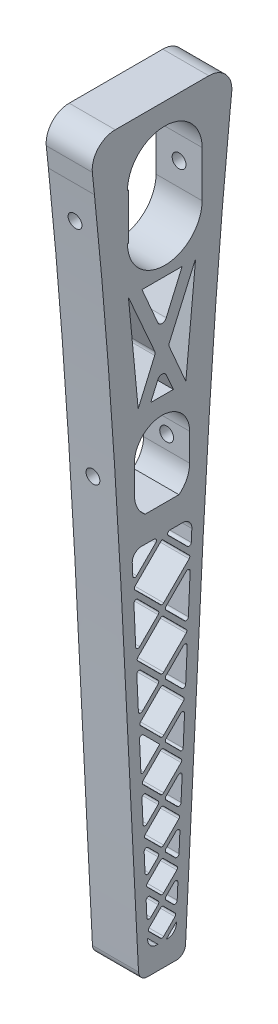
from build123d import *

# Parameters (mm, degrees)
BOSS_EXTRUDE1_DEPTH      = 5
BOSS_EXTRUDE1_DEPTH_BACK = 5
CUT_EXTRUDE1_DEPTH       = 28
CUT_EXTRUDE1_DEPTH_BACK  = 20
SKETCH4_R                = 1.5
CUT_EXTRUDE2_DEPTH       = 20
CUT_EXTRUDE2_DEPTH_BACK  = 20
SKETCH5_R                = 1.5
SKETCH6_W                = 10
SKETCH6_H                = 10
SKETCH6_R                = 1.5
BOSS_EXTRUDE2_DEPTH      = 0.2
SKETCH7_W                = 10
SKETCH7_H                = 10
SKETCH7_R                = 1.5
CUT_EXTRUDE3_DEPTH       = 1.2
SKETCH8_W                = 10
SKETCH8_H                = 6
SKETCH8_R                = 1.5
CUT_EXTRUDE4_DEPTH       = 1
SKETCH9_W                = 10
SKETCH9_H                = 6
SKETCH9_R                = 1.5
CUT_EXTRUDE5_DEPTH       = 1
FILLET6_R                = 1
CUT_EXTRUDE10_DEPTH      = 10
CUT_EXTRUDE11_DEPTH      = 10
CUT_EXTRUDE12_DEPTH      = 10
BOSS_EXTRUDE3_DEPTH      = 10
FILLET7_R                = 5
CUT_EXTRUDE13_DEPTH      = 10
FILLET8_R                = 2


with BuildPart() as part:
    # Sketch3 → Boss-Extrude1 (new, two sides: drawn at the far end of the back side and taken through both)
    with BuildSketch(Plane(origin=(0, 0, 0), x_dir=(0, 0, -1), z_dir=(1, 0, 0)).offset(-BOSS_EXTRUDE1_DEPTH_BACK)):
        with BuildLine():
            ThreePointArc((14.673342054, 7.823553619), (13.413781291, 11.688048034), (9.700098666, 13.340129074))
            Line((9.700098666, 13.340129074), (-9.700098666, 13.340129074))
            ThreePointArc((-9.700098666, 13.340129074), (-13.413781291, 11.688048034), (-14.673342054, 7.823553619))
            add(Edge.make_bspline(
                [(-14.673342054, 7.823553619), (-9.398583111, -42.958301773), (-7.813515176, -94.068374443), (-5, -145)],
                knots=[0.014278199, 0.014278199, 0.014278199, 0.014278199, 1, 1, 1, 1], degree=3))
            Line((-5, -145), (5, -145))
            add(Edge.make_bspline(
                [(14.673342054, 7.823553619), (9.398583111, -42.958301773), (7.813515176, -94.068374443), (5, -145)],
                knots=[0.014278199, 0.014278199, 0.014278199, 0.014278199, 1, 1, 1, 1], degree=3))
        make_face()
        with BuildLine():
            Line((-3.129448831, -138), (-3.129448831, -137.773163477))
            Line((-3.129448831, -137.773163477), (-0.902612308, -140))
            Line((-0.902612308, -140), (-1.129448831, -140))
            ThreePointArc((-1.129448831, -140), (-2.543662393, -139.414213562), (-3.129448831, -138))
        make_face(mode=Mode.SUBTRACT)
        with BuildLine():
            Line((-3.28908311, -133.832708929), (-3.443508103, -130.513250922))
            ThreePointArc((-3.443508103, -130.513250922), (-3.146074586, -130.032647605), (-2.59049489, -130.136462088))
            Line((-2.59049489, -130.136462088), (-0.853553391, -131.873403588))
            ThreePointArc((-0.853553391, -131.873403588), (-0.707106781, -132.226956978), (-0.853553391, -132.580510369))
            Line((-0.853553391, -132.580510369), (-2.436069897, -134.163026876))
            ThreePointArc((-2.436069897, -134.163026876), (-2.970177042, -134.275735581), (-3.28908311, -133.832708929))
        make_face(mode=Mode.SUBTRACT)
        with BuildLine():
            Line((-3.687981166, -125.258155544), (-3.881331395, -121.101976191))
            ThreePointArc((-3.881331395, -121.101976191), (-3.583897878, -120.621372874), (-3.028318182, -120.725187357))
            Line((-3.028318182, -120.725187357), (-0.853553391, -122.899952148))
            ThreePointArc((-0.853553391, -122.899952148), (-0.707106781, -123.253505539), (-0.853553391, -123.607058929))
            Line((-0.853553391, -123.607058929), (-2.834967953, -125.588473491))
            ThreePointArc((-2.834967953, -125.588473491), (-3.369075098, -125.701182196), (-3.687981166, -125.258155544))
        make_face(mode=Mode.SUBTRACT)
        with BuildLine():
            Line((-4.125804458, -115.846880813), (-4.166694273, -114.967929655))
            Line((-4.166694273, -114.967929655), (-4.361878322, -110.77233124))
            ThreePointArc((-4.361878322, -110.77233124), (-4.064444805, -110.291727923), (-3.508865109, -110.395542406))
            Line((-3.508865109, -110.395542406), (-0.853553391, -113.050854125))
            ThreePointArc((-0.853553391, -113.050854125), (-0.707106781, -113.404407515), (-0.853553391, -113.757960906))
            Line((-0.853553391, -113.757960906), (-3.272791245, -116.17719876))
            ThreePointArc((-3.272791245, -116.17719876), (-3.80689839, -116.289907465), (-4.125804458, -115.846880813))
        make_face(mode=Mode.SUBTRACT)
        with BuildLine():
            ThreePointArc((-4.88931794, -99.434699745), (-4.591884423, -98.954096428), (-4.036304727, -99.057910911))
            Line((-4.036304727, -99.057910911), (-0.5, -102.594215637))
            Line((-0.5, -102.594215637), (-3.993461302, -106.087676939))
            ThreePointArc((-3.993461302, -106.087676939), (-4.367336303, -106.166573032), (-4.590570551, -105.856454376))
            Line((-4.590570551, -105.856454376), (-4.88931794, -99.434699745))
        make_face(mode=Mode.SUBTRACT)
        with BuildLine():
            Line((-5.133791002, -94.179604367), (-5.468226125, -86.990720447))
            ThreePointArc((-5.468226125, -86.990720447), (-5.170792608, -86.510117129), (-4.615212912, -86.613931613))
            Line((-4.615212912, -86.613931613), (-0.853553391, -90.375591134))
            ThreePointArc((-0.853553391, -90.375591134), (-0.707106781, -90.729144525), (-0.853553391, -91.082697915))
            Line((-0.853553391, -91.082697915), (-4.280777789, -94.509922314))
            ThreePointArc((-4.280777789, -94.509922314), (-4.814884934, -94.622631019), (-5.133791002, -94.179604367))
        make_face(mode=Mode.SUBTRACT)
        with BuildLine():
            Line((-6.348098343, -68.07733843), (-6.46774261, -65.505513021))
            ThreePointArc((-6.46774261, -65.505513021), (-5.916603626, -64.031608457), (-4.469903321, -63.412571246))
            Line((-4.469903321, -63.412571246), (-1.707106781, -63.412571246))
            ThreePointArc((-1.707106781, -63.412571246), (-1.245167015, -63.72122953), (-1.353553391, -64.266124637))
            Line((-1.353553391, -64.266124637), (-5.49508513, -68.407656377))
            ThreePointArc((-5.49508513, -68.407656377), (-6.029192275, -68.520365082), (-6.348098343, -68.07733843))
        make_face(mode=Mode.SUBTRACT)
        with BuildLine():
            Line((-5.712699188, -81.735625069), (-6.103625281, -73.332433808))
            ThreePointArc((-6.103625281, -73.332433808), (-5.806191764, -72.85183049), (-5.250612068, -72.955644973))
            Line((-5.250612068, -72.955644973), (-0.853553391, -77.35270365))
            ThreePointArc((-0.853553391, -77.35270365), (-0.707106781, -77.706257041), (-0.853553391, -78.059810432))
            Line((-0.853553391, -78.059810432), (-4.859685975, -82.065943016))
            ThreePointArc((-4.859685975, -82.065943016), (-5.39379312, -82.178651721), (-5.712699188, -81.735625069))
        make_face(mode=Mode.SUBTRACT)
        with BuildLine():
            Line((-2.820060712, -135.961231252), (-0.353553391, -133.494723931))
            ThreePointArc((-0.353553391, -133.494723931), (0, -133.348277322), (0.353553391, -133.494723931))
            Line((0.353553391, -133.494723931), (2.820060712, -135.961231252))
            ThreePointArc((2.820060712, -135.961231252), (2.966507321, -136.314784643), (2.820060712, -136.668338034))
            Line((2.820060712, -136.668338034), (0.353553391, -139.134845355))
            ThreePointArc((0.353553391, -139.134845355), (0, -139.281291964), (-0.353553391, -139.134845355))
            Line((-0.353553391, -139.134845355), (-2.820060712, -136.668338034))
            ThreePointArc((-2.820060712, -136.668338034), (-2.966507321, -136.314784643), (-2.820060712, -135.961231252))
        make_face(mode=Mode.SUBTRACT)
        with BuildLine():
            Line((3.129494185, -137.773118123), (3.129494185, -138))
            ThreePointArc((3.129494185, -138), (2.543707747, -139.414213562), (1.129494185, -140))
            Line((1.129494185, -140), (0.902612308, -140))
            Line((0.902612308, -140), (3.129494185, -137.773118123))
        make_face(mode=Mode.SUBTRACT)
        with BuildLine():
            Line((-3.218958767, -127.386677868), (-0.353553391, -124.521272492))
            ThreePointArc((-0.353553391, -124.521272492), (0, -124.374825882), (0.353553391, -124.521272492))
            Line((0.353553391, -124.521272492), (3.218958767, -127.386677868))
            ThreePointArc((3.218958767, -127.386677868), (3.365405376, -127.740231259), (3.218958767, -128.093784649))
            Line((3.218958767, -128.093784649), (0.353553391, -130.959190025))
            ThreePointArc((0.353553391, -130.959190025), (0, -131.105636635), (-0.353553391, -130.959190025))
            Line((-0.353553391, -130.959190025), (-3.218958767, -128.093784649))
            ThreePointArc((-3.218958767, -128.093784649), (-3.365405376, -127.740231259), (-3.218958767, -127.386677868))
        make_face(mode=Mode.SUBTRACT)
        with BuildLine():
            ThreePointArc((3.28908311, -133.832708929), (2.970177042, -134.275735581), (2.436069897, -134.163026876))
            Line((2.436069897, -134.163026876), (0.853553391, -132.580510369))
            ThreePointArc((0.853553391, -132.580510369), (0.707106781, -132.226956978), (0.853553391, -131.873403588))
            Line((0.853553391, -131.873403588), (2.59049489, -130.136462088))
            ThreePointArc((2.59049489, -130.136462088), (3.146074586, -130.032647605), (3.443508103, -130.513250922))
            Line((3.443508103, -130.513250922), (3.28908311, -133.832708929))
        make_face(mode=Mode.SUBTRACT)
        with BuildLine():
            ThreePointArc((-0.353553391, -114.672174468), (0, -114.525727859), (0.353553391, -114.672174468))
            Line((0.353553391, -114.672174468), (3.656782059, -117.975403136))
            ThreePointArc((3.656782059, -117.975403136), (3.803228668, -118.328956527), (3.656782059, -118.682509918))
            Line((3.656782059, -118.682509918), (0.353553391, -121.985738586))
            ThreePointArc((0.353553391, -121.985738586), (0, -122.132185195), (-0.353553391, -121.985738586))
            Line((-0.353553391, -121.985738586), (-3.656782059, -118.682509918))
            ThreePointArc((-3.656782059, -118.682509918), (-3.803228668, -118.328956527), (-3.656782059, -117.975403136))
            Line((-3.656782059, -117.975403136), (-0.353553391, -114.672174468))
        make_face(mode=Mode.SUBTRACT)
        with BuildLine():
            ThreePointArc((3.687981166, -125.258155544), (3.369075098, -125.701182196), (2.834967953, -125.588473491))
            Line((2.834967953, -125.588473491), (0.853553391, -123.607058929))
            ThreePointArc((0.853553391, -123.607058929), (0.707106781, -123.253505539), (0.853553391, -122.899952148))
            Line((0.853553391, -122.899952148), (3.028318182, -120.725187357))
            ThreePointArc((3.028318182, -120.725187357), (3.583897878, -120.621372874), (3.881331395, -121.101976191))
            Line((3.881331395, -121.101976191), (3.687981166, -125.258155544))
        make_face(mode=Mode.SUBTRACT)
        with BuildLine():
            Line((-4.137328986, -107.645758186), (-0.353553391, -103.86198259))
            ThreePointArc((-0.353553391, -103.86198259), (0, -103.715535981), (0.353553391, -103.86198259))
            Line((0.353553391, -103.86198259), (4.137328986, -107.645758186))
            ThreePointArc((4.137328986, -107.645758186), (4.283775595, -107.999311576), (4.137328986, -108.352864967))
            Line((4.137328986, -108.352864967), (0.353553391, -112.136640562))
            ThreePointArc((0.353553391, -112.136640562), (0, -112.283087172), (-0.353553391, -112.136640562))
            Line((-0.353553391, -112.136640562), (-4.137328986, -108.352864967))
            ThreePointArc((-4.137328986, -108.352864967), (-4.283775595, -107.999311576), (-4.137328986, -107.645758186))
        make_face(mode=Mode.SUBTRACT)
        with BuildLine():
            ThreePointArc((4.125804458, -115.846880813), (3.80689839, -116.289907465), (3.272791245, -116.17719876))
            Line((3.272791245, -116.17719876), (0.853553391, -113.757960906))
            ThreePointArc((0.853553391, -113.757960906), (0.707106781, -113.404407515), (0.853553391, -113.050854125))
            Line((0.853553391, -113.050854125), (3.508865109, -110.395542406))
            ThreePointArc((3.508865109, -110.395542406), (4.064444805, -110.291727923), (4.361878322, -110.77233124))
            Line((4.361878322, -110.77233124), (4.125804458, -115.846880813))
        make_face(mode=Mode.SUBTRACT)
        with BuildLine():
            Line((-4.664768603, -96.30812669), (-0.353553391, -91.996911478))
            ThreePointArc((-0.353553391, -91.996911478), (0, -91.850464868), (0.353553391, -91.996911478))
            Line((0.353553391, -91.996911478), (4.664768603, -96.30812669))
            ThreePointArc((4.664768603, -96.30812669), (4.811215213, -96.661680081), (4.664768603, -97.015233472))
            Line((4.664768603, -97.015233472), (0.353553391, -101.326448684))
            ThreePointArc((0.353553391, -101.326448684), (0, -101.472895294), (-0.353553391, -101.326448684))
            Line((-0.353553391, -101.326448684), (-4.664768603, -97.015233472))
            ThreePointArc((-4.664768603, -97.015233472), (-4.811215213, -96.661680081), (-4.664768603, -96.30812669))
        make_face(mode=Mode.SUBTRACT)
        with BuildLine():
            ThreePointArc((4.036304727, -99.057910911), (4.591884423, -98.954096428), (4.88931794, -99.434699745))
            Line((4.88931794, -99.434699745), (4.590570551, -105.856454376))
            ThreePointArc((4.590570551, -105.856454376), (4.367336303, -106.166573032), (3.993461302, -106.087676939))
            Line((3.993461302, -106.087676939), (0.853553391, -102.947769028))
            ThreePointArc((0.853553391, -102.947769028), (0.707106781, -102.594215637), (0.853553391, -102.240662247))
            Line((0.853553391, -102.240662247), (4.036304727, -99.057910911))
        make_face(mode=Mode.SUBTRACT)
        with BuildLine():
            ThreePointArc((4.615212912, -86.613931613), (5.170792608, -86.510117129), (5.468226125, -86.990720447))
            Line((5.468226125, -86.990720447), (5.133791002, -94.179604367))
            ThreePointArc((5.133791002, -94.179604367), (4.814884934, -94.622631019), (4.280777789, -94.509922314))
            Line((4.280777789, -94.509922314), (0.853553391, -91.082697915))
            ThreePointArc((0.853553391, -91.082697915), (0.707106781, -90.729144525), (0.853553391, -90.375591134))
            Line((0.853553391, -90.375591134), (4.615212912, -86.613931613))
        make_face(mode=Mode.SUBTRACT)
        with BuildLine():
            ThreePointArc((-5.243676789, -84.571254173), (-5.390123398, -84.217700783), (-5.243676789, -83.864147392))
            Line((-5.243676789, -83.864147392), (-0.353553391, -78.974023994))
            ThreePointArc((-0.353553391, -78.974023994), (0, -78.827577385), (0.353553391, -78.974023994))
            Line((0.353553391, -78.974023994), (5.243676789, -83.864147392))
            ThreePointArc((5.243676789, -83.864147392), (5.390123398, -84.217700783), (5.243676789, -84.571254173))
            Line((5.243676789, -84.571254173), (0.353553391, -89.461377572))
            ThreePointArc((0.353553391, -89.461377572), (0, -89.607824181), (-0.353553391, -89.461377572))
            Line((-0.353553391, -89.461377572), (-5.243676789, -84.571254173))
        make_face(mode=Mode.SUBTRACT)
        with BuildLine():
            ThreePointArc((5.250612068, -72.955644973), (5.806191764, -72.85183049), (6.103625281, -73.332433808))
            Line((6.103625281, -73.332433808), (5.712699188, -81.735625069))
            ThreePointArc((5.712699188, -81.735625069), (5.39379312, -82.178651721), (4.859685975, -82.065943016))
            Line((4.859685975, -82.065943016), (0.853553391, -78.059810432))
            ThreePointArc((0.853553391, -78.059810432), (0.707106781, -77.706257041), (0.853553391, -77.35270365))
            Line((0.853553391, -77.35270365), (5.250612068, -72.955644973))
        make_face(mode=Mode.SUBTRACT)
        with BuildLine():
            ThreePointArc((-5.879075944, -70.912967534), (-6.025522554, -70.559414144), (-5.879075944, -70.205860753))
            Line((-5.879075944, -70.205860753), (0, -64.326784809))
            Line((0, -64.326784809), (5.879075944, -70.205860753))
            ThreePointArc((5.879075944, -70.205860753), (6.025522554, -70.559414144), (5.879075944, -70.912967534))
            Line((5.879075944, -70.912967534), (0.353553391, -76.438490088))
            ThreePointArc((0.353553391, -76.438490088), (0, -76.584936697), (-0.353553391, -76.438490088))
            Line((-0.353553391, -76.438490088), (-5.879075944, -70.912967534))
        make_face(mode=Mode.SUBTRACT)
        with BuildLine():
            ThreePointArc((4.469903321, -63.412571246), (5.916603626, -64.031608457), (6.46774261, -65.505513021))
            Line((6.46774261, -65.505513021), (6.348098343, -68.07733843))
            ThreePointArc((6.348098343, -68.07733843), (6.029192275, -68.520365082), (5.49508513, -68.407656377))
            Line((5.49508513, -68.407656377), (1.353553391, -64.266124637))
            ThreePointArc((1.353553391, -64.266124637), (1.245167015, -63.72122953), (1.707106781, -63.412571246))
            Line((1.707106781, -63.412571246), (4.469903321, -63.412571246))
        make_face(mode=Mode.SUBTRACT)
        Polygon((0, -31.771706045), (2.45778508, -37.362157609), (-2.45778508, -37.362157609), align=None, mode=Mode.SUBTRACT)
        Polygon((-1.423120665, -28.534691056), (-5.17383123, -37.203074176), (-7.289389361, -15.191339245), align=None, mode=Mode.SUBTRACT)
        Polygon((0, -25.245672901), (-4.351754535, -15.188198487), (4.351754535, -15.188198487), align=None, mode=Mode.SUBTRACT)
        with BuildLine():
            Line((-5, -53), (-5, -47))
            add(Edge.make_bspline(
                [(5, -47), (5, -44), (0, -44), (-5, -44), (-5, -47)],
                knots=[0, 0, 0, 1.570796327, 1.570796327, 3.141592654, 3.141592654, 3.141592654], degree=2, weights=[1, 0.707106781, 1, 0.707106781, 1]))
            Line((5, -47), (5, -53))
            add(Edge.make_bspline(
                [(-5, -53), (-5, -56), (0, -56), (5, -56), (5, -53)],
                knots=[3.141592654, 3.141592654, 3.141592654, 4.71238898, 4.71238898, 6.283185307, 6.283185307, 6.283185307], degree=2, weights=[1, 0.707106781, 1, 0.707106781, 1]))
        make_face(mode=Mode.SUBTRACT)
        Polygon((1.423120665, -28.534691056), (7.289389361, -15.191339245), (5.17383123, -37.203074176), align=None, mode=Mode.SUBTRACT)
        with BuildLine():
            add(Edge.make_bspline(
                [(7.5, 5), (7.5, 8), (0, 8), (-7.5, 8), (-7.5, 5)],
                knots=[3.141592654, 3.141592654, 3.141592654, 4.71238898, 4.71238898, 6.283185307, 6.283185307, 6.283185307], degree=2, weights=[1, 0.707106781, 1, 0.707106781, 1]))
            Line((7.5, 5), (7.5, -5))
            add(Edge.make_bspline(
                [(-7.5, -5), (-7.5, -8), (0, -8), (7.5, -8), (7.5, -5)],
                knots=[0, 0, 0, 1.570796327, 1.570796327, 3.141592654, 3.141592654, 3.141592654], degree=2, weights=[1, 0.707106781, 1, 0.707106781, 1]))
            Line((-7.5, -5), (-7.5, 5))
        make_face(mode=Mode.SUBTRACT)
    extrude(amount=BOSS_EXTRUDE1_DEPTH + BOSS_EXTRUDE1_DEPTH_BACK)

    # Sketch4 → Cut-Extrude1 (cut, two sides: drawn at the far end of the back side and taken through both)
    with BuildSketch(Plane(origin=(0, 0, 7.5), x_dir=(-1, 0, 0), z_dir=(0, 0, -1)).offset(-CUT_EXTRUDE1_DEPTH_BACK)):
        with Locations(Location((0, 0, 0), (0, 0, 180))):
            Circle(SKETCH4_R)
    extrude(amount=CUT_EXTRUDE1_DEPTH + CUT_EXTRUDE1_DEPTH_BACK, mode=Mode.SUBTRACT)

    # Sketch5 → Cut-Extrude2 (cut, two sides: drawn at the far end of the back side and taken through both)
    with BuildSketch(Plane(origin=(0, 0, 5), x_dir=(-1, 0, 0), z_dir=(0, 0, -1)).offset(-CUT_EXTRUDE2_DEPTH_BACK)):
        with Locations(Location((0, -50, 0), (0, 0, 180))):
            Circle(SKETCH5_R)
    extrude(amount=CUT_EXTRUDE2_DEPTH + CUT_EXTRUDE2_DEPTH_BACK, mode=Mode.SUBTRACT)

    # Sketch6 → Boss-Extrude2 (add)
    with BuildSketch(Plane(origin=(0, 0, 7.5), x_dir=(-1, 0, 0), z_dir=(0, 0, -1))):
        Rectangle(SKETCH6_W, SKETCH6_H)
        with Locations(Location((0, 0, 0), (0, 0, 180))):
            Circle(SKETCH6_R, mode=Mode.SUBTRACT)
    extrude(amount=BOSS_EXTRUDE2_DEPTH)

    # Sketch7 → Cut-Extrude3 (cut)
    with BuildSketch(Plane.XY.offset(-7.5)):
        Rectangle(SKETCH7_W, SKETCH7_H)
        Circle(SKETCH7_R, mode=Mode.SUBTRACT)
    extrude(amount=-CUT_EXTRUDE3_DEPTH, mode=Mode.SUBTRACT)

    # Sketch8 → Cut-Extrude4 (cut)
    with BuildSketch(Plane.XY.offset(-5)):
        with Locations((0, -50)):
            Rectangle(SKETCH8_W, SKETCH8_H)
        with Locations((0, -50)):
            Circle(SKETCH8_R, mode=Mode.SUBTRACT)
    extrude(amount=-CUT_EXTRUDE4_DEPTH, mode=Mode.SUBTRACT)

    # Sketch9 → Cut-Extrude5 (cut)
    with BuildSketch(Plane(origin=(0, 0, 5), x_dir=(-1, 0, 0), z_dir=(0, 0, -1))):
        with Locations((0, -50)):
            Rectangle(SKETCH9_W, SKETCH9_H)
        with Locations(Location((0, -50, 0), (0, 0, 180))):
            Circle(SKETCH9_R, mode=Mode.SUBTRACT)
    extrude(amount=-CUT_EXTRUDE5_DEPTH, mode=Mode.SUBTRACT)

    # Fillet6
    fillet6_edges = [part.edges().sort_by_distance(p)[0] for p in [
        (0, -28.534691056, 1.423120665),
        (0, -28.534691056, -1.423120665),
        (0, -25.245672901, 0),
        (0, -31.771706045, 0),
    ]]
    fillet(fillet6_edges, radius=FILLET6_R)

    # Sketch10 → Cut-Extrude10 (cut)
    with BuildSketch(Plane.ZY.offset(5)):
        with BuildLine():
            Line((-6, -53), (6, -53))
            ThreePointArc((6, -53), (5.384900995, -55.646288207), (3.665719575, -57.75))
            Line((3.665719575, -57.75), (-3.665719575, -57.75))
            ThreePointArc((-3.665719575, -57.75), (-5.384900995, -55.646288207), (-6, -53))
        make_face()
    extrude(amount=-CUT_EXTRUDE10_DEPTH, mode=Mode.SUBTRACT)

    # Sketch11 → Cut-Extrude11 (cut)
    with BuildSketch(Plane.ZY.offset(5)):
        with BuildLine():
            Line((-6, -47), (6, -47))
            ThreePointArc((6, -47), (0, -41), (-6, -47))
        make_face()
    extrude(amount=-CUT_EXTRUDE11_DEPTH, mode=Mode.SUBTRACT)

    # Sketch17 → Cut-Extrude12 (cut)
    with BuildSketch(Plane(origin=(5, 0, 0), x_dir=(0, 0, -1), z_dir=(1, 0, 0))):
        with BuildLine():
            Line((-7.5, -5), (8.7, -5))
            ThreePointArc((8.7, -5), (0.6, -13.1), (-7.5, -5))
        make_face()
    extrude(amount=-CUT_EXTRUDE12_DEPTH, mode=Mode.SUBTRACT)

    # Sketch19 → Boss-Extrude3 (add)
    with BuildSketch(Plane(origin=(5, 0, 0), x_dir=(0, 0, -1), z_dir=(1, 0, 0))):
        Polygon((-15.706492964, 17.770040396), (15.706492964, 17.770040396), (14.673342054, 7.823553619), (-14.673342054, 7.823553619), align=None)
    extrude(amount=-BOSS_EXTRUDE3_DEPTH)

    # Fillet7
    fillet7_edges = [part.edges().sort_by_distance(p)[0] for p in [
        (0, 17.770040396, 15.706492964),
        (0, 17.770040396, -15.706492964),
    ]]
    fillet(fillet7_edges, radius=FILLET7_R)

    # Sketch21 → Cut-Extrude13 (cut)
    with BuildSketch(Plane(origin=(5, 0, 0), x_dir=(0, 0, -1), z_dir=(1, 0, 0))):
        with BuildLine():
            Line((-7.5, 5), (8.7, 5))
            ThreePointArc((8.7, 5), (0.6, 13.1), (-7.5, 5))
        make_face()
    extrude(amount=-CUT_EXTRUDE13_DEPTH, mode=Mode.SUBTRACT)

    # Fillet8
    fillet8_edges = [part.edges().sort_by_distance(p)[0] for p in [
        (-2.5, -145, -5),
        (-2.5, -145, 5),
    ]]
    fillet(fillet8_edges, radius=FILLET8_R)


solid = part.part
